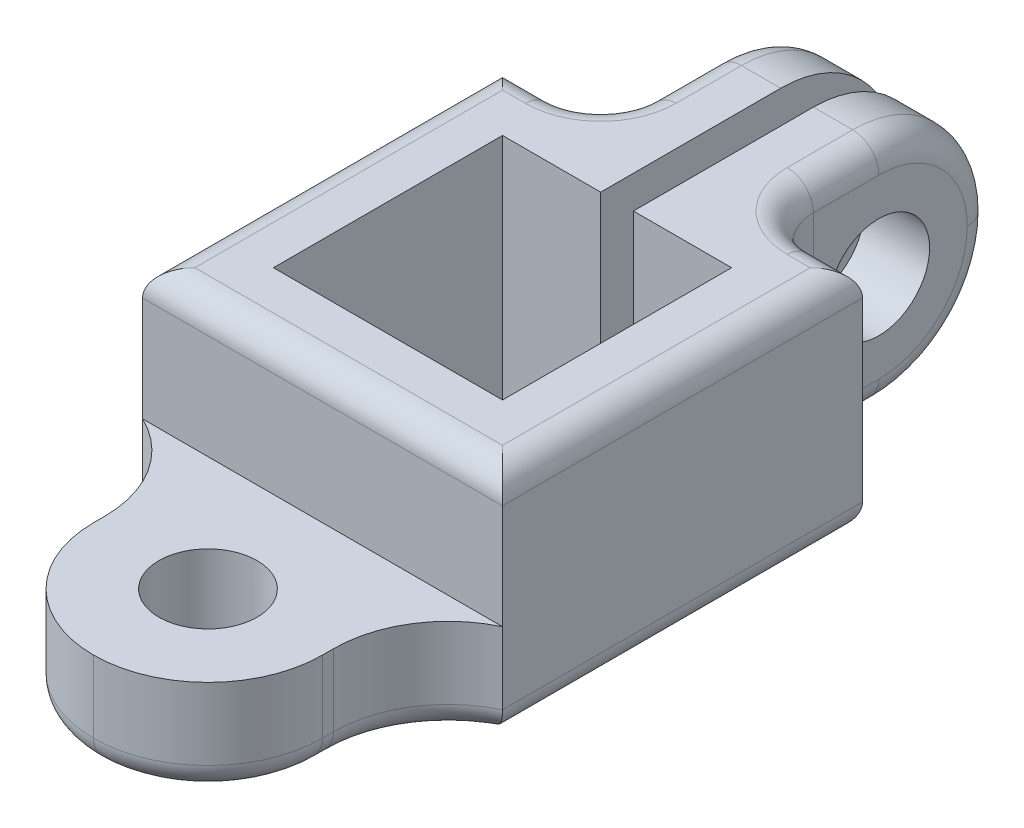
from build123d import *

# Parameters (mm, degrees)
SKETCH_1_W          = 2
SKETCH_1_H          = 7
EXTRUDE_2_DEPTH     = 7
FILLET_1_R          = 3.5
SKETCH_2_R          = 1.55
CUT_EXTRUDE_1_DEPTH = 17.408839081
SKETCH_3_W          = 3.5
SKETCH_3_H          = 3
EXTRUDE_4_DEPTH     = 7
FILLET_2_R          = 3.5
SKETCH_4_R          = 1.5
CUT_EXTRUDE_2_DEPTH = 15.230249471
FILLET_3_R          = 3.5
FILLET_4_R          = 1.5
FILLET_5_R          = 0.8


# Some blends are built 0.0001 mm under size
with BuildPart() as part:
    # 草图1 → 凸台-拉伸2 (new body)
    with BuildSketch(Plane(origin=(0, 0, 0), x_dir=(1, 0, 0), z_dir=(0, 1, 0))):
        Polygon((-3.5, -3.5), (-3.5, 3.5), (-0.5, 3.5), (-0.5, 5.5), (-2.5, 5.5), (-5.5, 5.5), (-5.5, -5.5), (5.5, -5.5), (5.5, 5.5), (2.5, 5.5), (0.5, 5.5), (0.5, 3.5), (3.5, 3.5), (3.5, -3.5), align=None)
        with Locations((-1.5, 9)):
            Rectangle(SKETCH_1_W, SKETCH_1_H)
        with Locations((1.5, 9)):
            Rectangle(SKETCH_1_W, SKETCH_1_H)
    extrude(amount=EXTRUDE_2_DEPTH)

    # 圆角1
    fillet_1_edges = [part.edges().sort_by_distance(p)[0] for p in [
        (1.5, 7, -12.5),
        (1.5, 0, -12.5),
        (-1.5, 0, -12.5),
        (-1.5, 7, -12.5),
    ]]
    fillet(fillet_1_edges, radius=FILLET_1_R - 0.0001)  # a hair under: the kernel refuses the full size

    # 草图2 → 切除-拉伸1 (cut, through all)
    with BuildSketch(Plane(origin=(2.5, 0, 0), x_dir=(0, 0, -1), z_dir=(1, 0, 0))):
        with Locations((9, 3.5)):
            Circle(SKETCH_2_R)
    extrude(amount=-CUT_EXTRUDE_1_DEPTH, mode=Mode.SUBTRACT)

    # 草图3 → 凸台-拉伸4 (add)
    with BuildSketch(Plane.XY.offset(5.5)):
        with Locations((-1.75, 1.5)):
            Rectangle(SKETCH_3_W, SKETCH_3_H)
        with Locations((1.75, 1.5)):
            Rectangle(SKETCH_3_W, SKETCH_3_H)
    extrude(amount=EXTRUDE_4_DEPTH)

    # 圆角2
    fillet_2_edges = [part.edges().sort_by_distance(p)[0] for p in [
        (3.5, 1.5, 12.5),
        (-3.5, 1.5, 12.5),
    ]]
    fillet(fillet_2_edges, radius=FILLET_2_R - 0.0001)  # a hair under: the kernel refuses the full size

    # 草图4 → 切除-拉伸2 (cut, through all)
    with BuildSketch(Plane(origin=(0, 3, 0), x_dir=(1, 0, 0), z_dir=(0, 1, 0))):
        with Locations(Location((0, -9, 0), (0, 0, 180))):
            Circle(SKETCH_4_R)
    extrude(amount=-CUT_EXTRUDE_2_DEPTH, mode=Mode.SUBTRACT)

    # 圆角3
    # the kernel refuses this fillet: 3.5 mm, written as the material it adds along each edge
    with BuildSketch(Plane(origin=(3.5, 0, 5.5), x_dir=(1, 0, 0), z_dir=(0, 1, 0))) as fillet_3_piece_1:
        with BuildLine():
            CenterArc((3.5, -3.16227766), FILLET_3_R, 115.376933525, 64.623066475)
            Line((0, -3.16227766), (-0.07, -3.16227766))
            Line((-0.07, -3.16227766), (-0.07, 0))
            Line((-0.07, 0), (0, 0.07))
            ThreePointArc((0, 0.07), (1, 0.07), (1.97, 0.063245553))
            Line((1.97, 0.063245553), (2, 0))
        make_face()
    extrude(amount=3)
    with BuildSketch(Plane(origin=(-3.5, 3, 5.5), x_dir=(0, 0, 1), z_dir=(0, -1, 0))) as fillet_3_piece_2:
        with BuildLine():
            CenterArc((3.16227766, 3.5), FILLET_3_R, 205.376933525, 64.623066475)
            Line((0, 2), (-0.063245553, 1.97))
            ThreePointArc((-0.063245553, 1.97), (-0.07, 1), (-0.07, 0))
            Line((-0.07, 0), (0, -0.07))
            Line((0, -0.07), (3.16227766, -0.07))
            Line((3.16227766, -0.07), (3.16227766, 0))
        make_face()
    extrude(amount=3)

    # 圆角4
    fillet_4_edges = [part.edges().sort_by_distance(p)[0] for p in [
        (-2.5, 3.5, -5.5),
        (2.5, 3.5, -5.5),
    ]]
    fillet(fillet_4_edges, radius=FILLET_4_R)

    # 圆角5
    fillet_5_edges = [part.edges().sort_by_distance(p)[0] for p in [
        (4.041960108, 0, 6.791448967),
        (-4.041960108, 0, 6.791448967),
        (4.75, 0, -5.5),
        (4.75, 7, -5.5),
        (-2.939339828, 0, -5.939339828),
        (-2.939339828, 7, -5.939339828),
        (2.939339828, 0, -5.939339828),
        (2.939339828, 7, -5.939339828),
        (5.5, 0, 0),
        (-5.5, 0, 0),
        (-4.75, 0, -5.5),
        (2.5, 0, -8.00005),
        (2.5, 7, -8.00005),
        (2.5, 1.025096977, -11.474903023),
        (2.5, 5.974903023, -11.474903023),
        (-2.5, 7, -8.00005),
        (-2.5, 0, -8.00005),
        (-4.75, 7, -5.5),
        (-2.5, 5.974903023, -11.474903023),
        (-2.5, 1.025096977, -11.474903023),
        (-5.5, 7, 0),
        (0, 7, 5.5),
        (5.5, 7, 0),
        (3.5, 0, 8.83118883),
        (-3.5, 0, 8.83118883),
        (-2.474903023, 0, 11.474903023),
        (2.474903023, 0, 11.474903023),
    ]]
    fillet(fillet_5_edges, radius=FILLET_5_R)


solid = part.part
